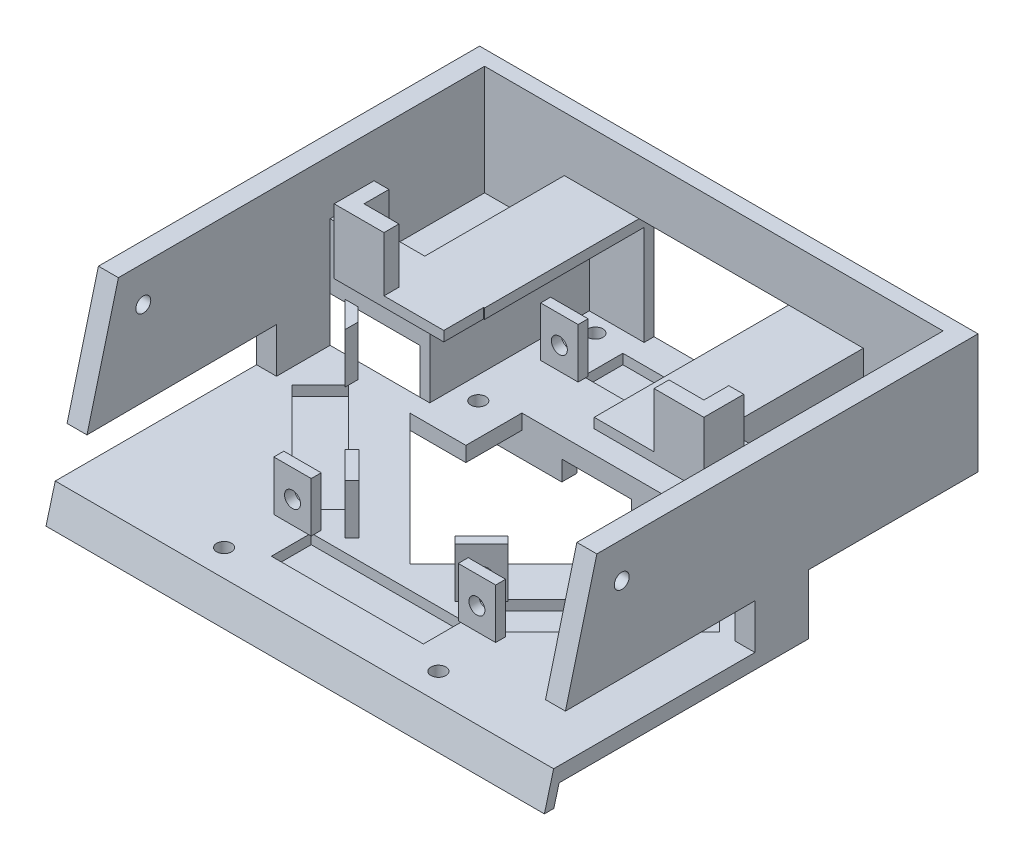
from build123d import *

# Parameters (mm, degrees)
RESSALTO_EXTRUS_O1_DEPTH  = 100
ESBO_O3_W                 = 56
ESBO_O3_H                 = 34
RESSALTO_EXTRUS_O2_DEPTH  = 3
CORTE_EXTRUS_O1_DEPTH     = 100
RESSALTO_EXTRUS_O4_DEPTH  = 100
CORTE_EXTRUS_O3_DEPTH     = 133.564862205
RESSALTO_EXTRUS_O7_DEPTH  = 56
ESBO_O15_R                = 1.5
CORTE_EXTRUS_O4_DEPTH     = 133.625424528
ESBO_O16_R                = 1.5
CORTE_EXTRUS_O5_DEPTH     = 133.625424528
ESBO_O17_W                = 30.5
ESBO_O17_H                = 8
CORTE_EXTRUS_O6_DEPTH     = 2
CORTE_EXTRUS_O7_DEPTH     = 2
ESBO_O19_W                = 30.5
ESBO_O19_H                = 8
CORTE_EXTRUS_O8_DEPTH     = 2
CORTE_EXTRUS_O10_DEPTH    = 6
ESBO_O38_W                = 13
ESBO_O38_H                = 2
RESSALTO_EXTRUS_O15_DEPTH = 20
RESSALTO_EXTRUS_O16_DEPTH = 4
RESSALTO_EXTRUS_O17_DEPTH = 4
ESBO_O43_W                = 34
ESBO_O43_H                = 2
RESSALTO_EXTRUS_O18_DEPTH = 13
ESBO_O45_W                = 34
ESBO_O45_H                = 2
RESSALTO_EXTRUS_O19_DEPTH = 13
ESBO_O46_W                = 32
ESBO_O46_H                = 11
RESSALTO_EXTRUS_O20_DEPTH = 2
ESBO_O47_W                = 22
ESBO_O47_H                = 2
RESSALTO_EXTRUS_O21_DEPTH = 34
ESBO_O48_W                = 32
ESBO_O48_H                = 11
RESSALTO_EXTRUS_O22_DEPTH = 2
ESBO_O49_W                = 32
ESBO_O49_H                = 2
RESSALTO_EXTRUS_O23_DEPTH = 22
RESSALTO_EXTRUS_O32_DEPTH = 34
ESBO_O53_W                = 20
ESBO_O53_H                = 3
RESSALTO_EXTRUS_O33_DEPTH = 11
ESBO_O55_W                = 20
ESBO_O55_H                = 11
RESSALTO_EXTRUS_O34_DEPTH = 3
ESBO_O56_W                = 4
ESBO_O56_H                = 28
RESSALTO_EXTRUS_O35_DEPTH = 22
ESBO_O57_W                = 100
ESBO_O57_H                = 3
RESSALTO_EXTRUS_O36_DEPTH = 11
ESBO_O59_W                = 4
ESBO_O59_H                = 3
RESSALTO_EXTRUS_O38_DEPTH = 11
ESBO_O60_W                = 2
ESBO_O60_H                = 2
RESSALTO_EXTRUS_O39_DEPTH = 22
ESBO_O25_W                = 7.52
ESBO_O25_H                = 2
ESBO_O25_W_2              = 7.5
RESSALTO_EXTRUS_O11_DEPTH = 10
ESBO_O26_R                = 1.6
ESBO_O26_R_2              = 1.599799532
CORTE_EXTRUS_O11_DEPTH    = 58
ESBO_O27_R                = 1.6
CORTE_EXTRUS_O12_DEPTH    = 10
ESBO_O28_R                = 1.6
CORTE_EXTRUS_O13_DEPTH    = 10
ESBO_O62_W                = 22
ESBO_O62_H                = 2
RESSALTO_EXTRUS_O40_DEPTH = 8
RESSALTO_EXTRUS_O41_DEPTH = 11
ESBO_O64_R                = 1.5
CORTE_EXTRUS_O14_DEPTH    = 138.191699822


with BuildPart() as part:
    # Esboço1 → Ressalto-extrusão1 (new body)
    with BuildSketch(Plane(origin=(0, 0, 0), x_dir=(0, 0, -1), z_dir=(1, 0, 0))):
        Polygon((0, 0), (52.75, 0), (52.75, 3), (3.909676119, 3), (19.986193235, 62.998378686), (17.088415756, 63.774835821), align=None)
    extrude(amount=RESSALTO_EXTRUS_O1_DEPTH)

    # Esboço3 → Ressalto-extrusão2 (add)
    with BuildSketch(Plane(origin=(0, 3, 0), x_dir=(1, 0, 0), z_dir=(0, 1, 0))):
        with Locations((50, 69.75)):
            Rectangle(ESBO_O3_W, ESBO_O3_H)
    extrude(amount=-RESSALTO_EXTRUS_O2_DEPTH)

    # Esboço5 → Corte-extrusão1 (cut)
    with BuildSketch(Plane(origin=(100, 0, 0), x_dir=(0, 0, -1), z_dir=(1, 0, 0))):
        Polygon((3.909676119, 3), (1.604088206, 3), (0.800240629, 0), (0, 0), (17.088415756, 63.774835821), (19.986193235, 62.998378686), align=None)
    extrude(amount=-CORTE_EXTRUS_O1_DEPTH, mode=Mode.SUBTRACT)

    # Esboço6 → Ressalto-extrusão4 (add)
    with BuildSketch(Plane(origin=(100, 0, 0), x_dir=(0, 0, -1), z_dir=(1, 0, 0))):
        Polygon((1.64900247, -3.919551387), (-0.25, -3.919551387), (0.800240629, 0), (2.700240629, 0), align=None)
    extrude(amount=-RESSALTO_EXTRUS_O4_DEPTH)

    # Esboço13 → Corte-extrusão3 (cut, through all)
    with BuildSketch(Plane(origin=(0, 3, 0), x_dir=(1, 0, 0), z_dir=(0, 1, 0))):
        Polygon((35, 37.75), (50, 22.75), (65, 37.75), (76.244220691, 48.994220691), (65, 48.994220691), (65, 60.238441382), (35, 60.238441382), (35, 48.994220691), (23.755779309, 48.994220691), align=None)
    extrude(amount=-CORTE_EXTRUS_O3_DEPTH, mode=Mode.SUBTRACT)

    # Esboço14 → Ressalto-extrusão7 (add)
    with BuildSketch(Plane(origin=(78, 0, 0), x_dir=(0, 0, -1), z_dir=(1, 0, 0))):
        with BuildLine():
            Line((60.238441382, -4.996294845), (63.238441382, -4.996294845))
            ThreePointArc((63.238441382, -4.996294845), (63.853060368, -2.237261337), (65.5806842, 0))
            Line((65.5806842, 0), (63.238441382, 0))
            Line((63.238441382, 0), (60.238441382, 0))
            Line((60.238441382, 0), (60.238441382, -4.996294845))
        make_face()
        with BuildLine():
            Line((79.23840166, -4.996294845), (76.23840166, -4.996294845))
            ThreePointArc((76.23840166, -4.996294845), (75.623782675, -2.237261337), (73.896158842, 0))
            Line((73.896158842, 0), (76.23840166, 0.003705155))
            Line((76.23840166, 0.003705155), (79.23840166, 0.003705155))
            Line((79.23840166, 0.003705155), (79.23840166, -4.996294845))
        make_face()
    extrude(amount=-RESSALTO_EXTRUS_O7_DEPTH)

    # Esboço15 → Corte-extrusão4 (cut, through all)
    with BuildSketch(Plane(origin=(0, 3, 0), x_dir=(1, 0, 0), z_dir=(0, 1, 0))):
        with Locations((28.5, 81.49340166)):
            Circle(ESBO_O15_R)
        with Locations((28.5, 57.983441382)):
            Circle(ESBO_O15_R)
        with Locations((71.5, 81.49340166)):
            Circle(ESBO_O15_R)
        with Locations((71.5, 57.983441382)):
            Circle(ESBO_O15_R)
    extrude(amount=-CORTE_EXTRUS_O4_DEPTH, mode=Mode.SUBTRACT)

    # Esboço16 → Corte-extrusão5 (cut, through all)
    with BuildSketch(Plane(origin=(0, 3, 0), x_dir=(1, 0, 0), z_dir=(0, 1, 0))):
        with Locations((28.5, 6.983441382)):
            Circle(ESBO_O16_R)
        with Locations((71.5, 6.983441382)):
            Circle(ESBO_O16_R)
    extrude(amount=-CORTE_EXTRUS_O5_DEPTH, mode=Mode.SUBTRACT)

    # Esboço17 → Corte-extrusão6 (cut)
    with BuildSketch(Plane(origin=(0, 3, 0), x_dir=(1, 0, 0), z_dir=(0, 1, 0))):
        with Locations((50, 14.216592832)):
            Rectangle(ESBO_O17_W, ESBO_O17_H)
    extrude(amount=-CORTE_EXTRUS_O6_DEPTH, mode=Mode.SUBTRACT)

    # Esboço18 → Corte-extrusão7 (cut)
    with BuildSketch(Plane(origin=(0, 3, 0), x_dir=(1, 0, 0), z_dir=(0, 1, 0))):
        Polygon((7.105017596, 41.999759213), (7.458570986, 42.353312604), (12.761871845, 47.656613463), (12.870631818, 47.547853489), (34.328628671, 26.089856636), (28.671774422, 20.433002387), align=None)
        Polygon((92.89, 41.999759213), (87.233145751, 47.656613463), (65.666388924, 26.089856636), (71.323243174, 20.433002387), align=None)
    extrude(amount=-CORTE_EXTRUS_O7_DEPTH, mode=Mode.SUBTRACT)

    # Esboço19 → Corte-extrusão8 (cut)
    with BuildSketch(Plane(origin=(0, 3, 0), x_dir=(1, 0, 0), z_dir=(0, 1, 0))):
        with Locations((50, 76.75)):
            Rectangle(ESBO_O19_W, ESBO_O19_H)
    extrude(amount=-CORTE_EXTRUS_O8_DEPTH, mode=Mode.SUBTRACT)

    # Esboço20 → Corte-extrusão10 (cut)
    with BuildSketch(Plane.XY.offset(-60.238441382)):
        Polygon((50, -4.996294845), (43, -4.996294845), (43, -0.996294845), (57, -0.996294845), (57, -4.996294845), align=None)
    extrude(amount=-CORTE_EXTRUS_O10_DEPTH, mode=Mode.SUBTRACT)

    # Esboço38 → Ressalto-extrusão15 (add)
    with BuildSketch(Plane(origin=(0, 3, 0), x_dir=(1, 0, 0), z_dir=(0, 1, 0))):
        with Locations((28.5, 85.75)):
            Rectangle(ESBO_O38_W, ESBO_O38_H)
        with Locations((71.5, 85.75)):
            Rectangle(ESBO_O38_W, ESBO_O38_H)
    extrude(amount=RESSALTO_EXTRUS_O15_DEPTH)

    # Esboço40 → Ressalto-extrusão16 (add)
    with BuildSketch(Plane(origin=(100, 0, 0), x_dir=(0, 0, -1), z_dir=(1, 0, 0))):
        Polygon((52.75, 3), (52.75, 25), (52.75, 36), (10.269915824, 36), (7.402785764, 25), (5.948658388, 19.421110729), (3.968962471, 11.825830908), (41.999759213, 12), (41.999759213, 3), align=None)
    extrude(amount=-RESSALTO_EXTRUS_O16_DEPTH)

    # Esboço41 → Ressalto-extrusão17 (add)
    with BuildSketch(Plane.ZY):
        Polygon((-52.75, 3), (-52.75, 25), (-52.75, 36), (-10.269915824, 36), (-7.402785764, 25), (-3.968962471, 11.825830908), (-41.999759213, 12), (-41.999759213, 3), align=None)
    extrude(amount=-RESSALTO_EXTRUS_O17_DEPTH)

    # Esboço43 → Ressalto-extrusão18 (add)
    with BuildSketch(Plane(origin=(78, 0, 0), x_dir=(0, 0, -1), z_dir=(1, 0, 0))):
        with Locations((69.75, 24)):
            Rectangle(ESBO_O43_W, ESBO_O43_H)
    extrude(amount=-RESSALTO_EXTRUS_O18_DEPTH)

    # Esboço45 → Ressalto-extrusão19 (add)
    with BuildSketch(Plane.ZY.offset(-22)):
        with Locations((-69.75, 24)):
            Rectangle(ESBO_O45_W, ESBO_O45_H)
    extrude(amount=-RESSALTO_EXTRUS_O19_DEPTH)

    # Esboço46 → Ressalto-extrusão20 (add)
    with BuildSketch(Plane(origin=(78, 0, 0), x_dir=(0, 0, -1), z_dir=(1, 0, 0))):
        with Locations((68.75, 8.5)):
            Rectangle(ESBO_O46_W, ESBO_O46_H)
    extrude(amount=-RESSALTO_EXTRUS_O20_DEPTH)

    # Esboço47 → Ressalto-extrusão21 (add)
    with BuildSketch(Plane(origin=(0, 0, -52.75), x_dir=(-1, 0, 0), z_dir=(0, 0, -1))):
        with Locations((-89, 13)):
            Rectangle(ESBO_O47_W, ESBO_O47_H)
    extrude(amount=RESSALTO_EXTRUS_O21_DEPTH)

    # Esboço48 → Ressalto-extrusão22 (add)
    with BuildSketch(Plane.ZY.offset(-22)):
        with Locations((-68.75, 8.5)):
            Rectangle(ESBO_O48_W, ESBO_O48_H)
    extrude(amount=-RESSALTO_EXTRUS_O22_DEPTH)

    # Esboço49 → Ressalto-extrusão23 (add)
    with BuildSketch(Plane.ZY.offset(-22)):
        with Locations((-68.75, 13)):
            Rectangle(ESBO_O49_W, ESBO_O49_H)
    extrude(amount=RESSALTO_EXTRUS_O23_DEPTH)

    # Esboço51 → Ressalto-extrusão32 (add)
    with BuildSketch(Plane(origin=(0, 0, -86.75), x_dir=(-1, 0, 0), z_dir=(0, 0, -1))):
        Polygon((-76, 14), (-76, 23), (-78, 23), (-78, 25), (-80, 25), (-80, 14), align=None)
        Polygon((-24, 23), (-24, 14), (-20, 14), (-20, 25), (-22, 25), (-22, 23), align=None)
    extrude(amount=-RESSALTO_EXTRUS_O32_DEPTH)

    # Esboço53 → Ressalto-extrusão33 (add)
    with BuildSketch(Plane(origin=(0, 14, 0), x_dir=(1, 0, 0), z_dir=(0, 1, 0))):
        with Locations((10, 54.25)):
            Rectangle(ESBO_O53_W, ESBO_O53_H)
        with Locations((90, 54.25)):
            Rectangle(ESBO_O53_W, ESBO_O53_H)
    extrude(amount=RESSALTO_EXTRUS_O33_DEPTH)

    # Esboço55 → Ressalto-extrusão34 (add)
    with BuildSketch(Plane(origin=(0, 0, -86.75), x_dir=(-1, 0, 0), z_dir=(0, 0, -1))):
        with Locations((-90, 19.5)):
            Rectangle(ESBO_O55_W, ESBO_O55_H)
        with Locations((-10, 19.5)):
            Rectangle(ESBO_O55_W, ESBO_O55_H)
    extrude(amount=-RESSALTO_EXTRUS_O34_DEPTH)

    # Esboço56 → Ressalto-extrusão35 (add)
    with BuildSketch(Plane(origin=(0, 14, 0), x_dir=(1, 0, 0), z_dir=(0, 1, 0))):
        with Locations((2, 69.75)):
            Rectangle(ESBO_O56_W, ESBO_O56_H)
        with Locations((98, 69.75)):
            Rectangle(ESBO_O56_W, ESBO_O56_H)
    extrude(amount=RESSALTO_EXTRUS_O35_DEPTH)

    # Esboço57 → Ressalto-extrusão36 (add)
    with BuildSketch(Plane(origin=(0, 25, 0), x_dir=(1, 0, 0), z_dir=(0, 1, 0))):
        with Locations((50, 85.25)):
            Rectangle(ESBO_O57_W, ESBO_O57_H)
    extrude(amount=RESSALTO_EXTRUS_O36_DEPTH)

    # Esboço59 → Ressalto-extrusão38 (add)
    with BuildSketch(Plane(origin=(0, 25, 0), x_dir=(1, 0, 0), z_dir=(0, 1, 0))):
        with Locations((2, 54.25)):
            Rectangle(ESBO_O59_W, ESBO_O59_H)
        with Locations((98, 54.25)):
            Rectangle(ESBO_O59_W, ESBO_O59_H)
    extrude(amount=RESSALTO_EXTRUS_O38_DEPTH)

    # Esboço60 → Ressalto-extrusão39 (add)
    with BuildSketch(Plane.ZY):
        with Locations((-85.75, 13)):
            Rectangle(ESBO_O60_W, ESBO_O60_H)
    extrude(amount=-RESSALTO_EXTRUS_O39_DEPTH)

    # Esboço25 → Ressalto-extrusão11 (add)
    with BuildSketch(Plane(origin=(0, 3, 0), x_dir=(1, 0, 0), z_dir=(0, 1, 0))):
        with Locations((31.51, 72.25)):
            Rectangle(ESBO_O25_W, ESBO_O25_H)
        with Locations((68.5, 72.25)):
            Rectangle(ESBO_O25_W_2, ESBO_O25_H)
        Polygon((87.233145751, 46.949506681), (87.233145751, 49.601157111), (89.88479618, 52.25280754), (92.536446609, 52.25280754), align=None)
        Polygon((61.070194847, 20.786555778), (66.373495706, 26.089856636), (64.959282143, 27.504070199), (59.655981284, 22.20076934), align=None)
        Polygon((33.62152189, 26.089856636), (38.924822749, 20.786555778), (40.339036311, 22.20076934), (35.035735452, 27.504070199), align=None)
        Polygon((7.458570986, 52.25280754), (12.761871845, 46.949506681), (12.761871845, 49.601157111), (10.110221416, 52.25280754), align=None)
        with Locations((68.5, 18.716592832)):
            Rectangle(ESBO_O25_W_2, ESBO_O25_H)
        with Locations((31.5, 18.716592832)):
            Rectangle(ESBO_O25_W_2, ESBO_O25_H)
    extrude(amount=RESSALTO_EXTRUS_O11_DEPTH)

    # Esboço26 → Corte-extrusão11 (cut)
    with BuildSketch(Plane.XY.offset(-17.716592832)):
        with Locations((68.494816049, 7.5)):
            Circle(ESBO_O26_R)
        with Locations((31.500201547, 7.5)):
            Circle(ESBO_O26_R_2)
    extrude(amount=-CORTE_EXTRUS_O11_DEPTH, mode=Mode.SUBTRACT)

    # Esboço27 → Corte-extrusão12 (cut)
    with BuildSketch(Plane(origin=(29.855689263, 0, -29.855689263), x_dir=(0.7071067811865513, 0, 0.7071067811865438), z_dir=(-0.7071067811865438, 0, 0.7071067811865513))):
        with Locations((-27.924308426, 7.5)):
            Circle(ESBO_O27_R)
        with Locations((9.075691574, 7.5)):
            Circle(ESBO_O27_R)
    extrude(amount=-CORTE_EXTRUS_O12_DEPTH, mode=Mode.SUBTRACT)

    # Esboço28 → Corte-extrusão13 (cut)
    with BuildSketch(Plane(origin=(20.141819535, 0, 20.141819535), x_dir=(0.7071067811865511, 0, -0.707106781186544), z_dir=(0.707106781186544, 0, 0.7071067811865511))):
        with Locations((98.631463452, 7.5)):
            Circle(ESBO_O28_R)
        with Locations((61.631463452, 7.5)):
            Circle(ESBO_O28_R)
    extrude(amount=-CORTE_EXTRUS_O13_DEPTH, mode=Mode.SUBTRACT)

    # Esboço62 → Ressalto-extrusão40 (add)
    with BuildSketch(Plane.XY.offset(-52.75)):
        with Locations((23.813260122, 24)):
            Rectangle(ESBO_O62_W, ESBO_O62_H)
        with Locations((76, 24)):
            Rectangle(ESBO_O62_W, ESBO_O62_H)
    extrude(amount=RESSALTO_EXTRUS_O40_DEPTH)

    # Esboço63 → Ressalto-extrusão41 (add)
    with BuildSketch(Plane(origin=(0, 25, 0), x_dir=(1, 0, 0), z_dir=(0, 1, 0))):
        Polygon((15.813260122, 52.75), (12.813260122, 52.75), (12.813260122, 44.75), (22.813260122, 44.75), (22.813260122, 47.75), (15.813260122, 47.75), align=None)
        Polygon((77, 44.75), (87, 44.75), (87, 52.75), (84, 52.75), (84, 47.75), (77, 47.75), align=None)
    extrude(amount=RESSALTO_EXTRUS_O41_DEPTH)

    # Esboço64 → Corte-extrusão14 (cut, through all)
    with BuildSketch(Plane(origin=(100, 0, 0), x_dir=(0, 0, -1), z_dir=(1, 0, 0))):
        with Locations((15.269915824, 28.825830908)):
            Circle(ESBO_O64_R)
    extrude(amount=-CORTE_EXTRUS_O14_DEPTH, mode=Mode.SUBTRACT)


solid = part.part
